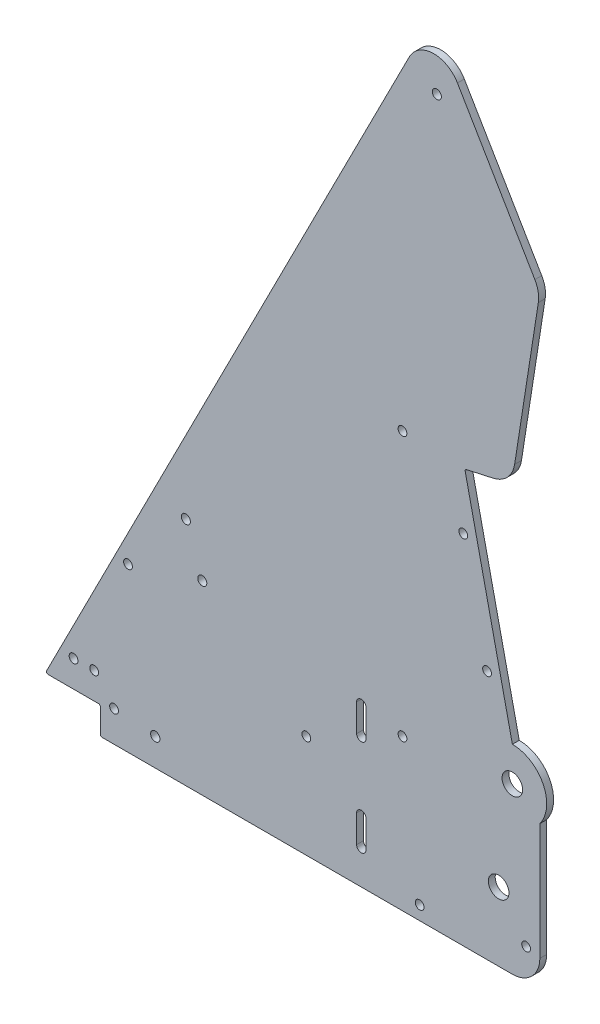
from build123d import *

# Parameters (mm, degrees)
BOSS_EXTRUDE1_DEPTH = 3.175
SKETCH2_R           = 2.0955
SKETCH2_R_2         = 2.032
SKETCH2_R_3         = 4.7625
CUT_EXTRUDE1_DEPTH  = 421.976111717
SKETCH7_R           = 2.159
CUT_EXTRUDE2_DEPTH  = 421.976111717
CUT_EXTRUDE3_REACH  = 422.976
SKETCH10_R          = 2.032
FILLET1_R           = 12.7
FILLET2_R           = 0.79375
SKETCH12_R          = 2.032
CUT_EXTRUDE5_DEPTH  = 410.593447353


with BuildPart() as part:
    # Sketch1 → Boss-Extrude1 (new body)
    with BuildSketch(Plane.XY):
        with BuildLine():
            Line((228.6, -12.7), (228.6, 53.975))
            ThreePointArc((228.6, 53.975), (230.099031657, 70.599515829), (215.9, 79.375))
            Line((215.9, 79.375), (193.909735224, 178.566674323))
            Line((193.909735224, 178.566674323), (215.607913982, 183.377044743))
            Line((215.607913982, 183.377044743), (228.6, 266.7))
            Line((228.6, 266.7), (178.754725958, 351.413083686))
            Line((178.754725958, 351.413083686), (0, 0))
            Line((0, 0), (25.4, 0))
            Line((25.4, 0), (25.4, -12.7))
            Line((25.4, -12.7), (228.6, -12.7))
        make_face()
    extrude(amount=BOSS_EXTRUDE1_DEPTH)

    # Sketch2 → Cut-Extrude1 (cut, through all)
    with BuildSketch(Plane.XY.offset(3.175)):
        with Locations((64.943150167, 94.057839899)):
            Circle(SKETCH2_R)
        with Locations((180.975, 322.164313376)):
            Circle(SKETCH2_R)
        with Locations((72.544547852, 73.173171402)):
            Circle(SKETCH2_R)
        with Locations((193.207821773, 152.394364194)):
            Circle(SKETCH2_R_2)
        with Locations((215.9, 63.5)):
            Circle(SKETCH2_R_3)
        with Locations((173.0375, -6.35)):
            Circle(SKETCH2_R_2)
        with Locations((204.202954161, 102.798527032)):
            Circle(SKETCH2_R_2)
        with Locations((209.55, 19.05)):
            Circle(SKETCH2_R_3)
        with Locations((165.1, 179.3875)):
            Circle(SKETCH2_R_2)
    extrude(amount=-CUT_EXTRUDE1_DEPTH, mode=Mode.SUBTRACT)

    # Sketch7 → Cut-Extrude2 (cut, through all)
    with BuildSketch(Plane.XY.offset(3.175)):
        with Locations((50.8, 0)):
            Circle(SKETCH7_R)
        with BuildLine():
            Line((143.891, 3.175), (143.891, 15.875))
            ThreePointArc((143.891, 15.875), (146.05, 18.034), (148.209, 15.875))
            Line((148.209, 15.875), (148.209, 3.175))
            ThreePointArc((148.209, 3.175), (146.05, 1.016), (143.891, 3.175))
        make_face()
        with BuildLine():
            Line((143.891, 47.625), (143.891, 60.325))
            ThreePointArc((143.891, 60.325), (146.05, 62.484), (148.209, 60.325))
            Line((148.209, 60.325), (148.209, 47.625))
            ThreePointArc((148.209, 47.625), (146.05, 45.466), (143.891, 47.625))
        make_face()
    extrude(amount=-CUT_EXTRUDE2_DEPTH, mode=Mode.SUBTRACT)

    # Sketch10 → Cut-Extrude3 (cut, up to next)
    with BuildSketch(Plane.XY.offset(3.175), mode=Mode.PRIVATE) as cut_extrude3_sk1:
        with Locations((165.1, 57.15)):
            Circle(SKETCH10_R)
    cut_extrude3_tool1 = extrude(cut_extrude3_sk1.sketch, amount=-CUT_EXTRUDE3_REACH, mode=Mode.PRIVATE) & part.part
    # Sketch10 → Cut-Extrude3 (cut, up to next)
    with BuildSketch(Plane.XY.offset(3.175), mode=Mode.PRIVATE) as cut_extrude3_sk2:
        with Locations((120.65, 34.925)):
            Circle(SKETCH10_R)
    cut_extrude3_tool2 = extrude(cut_extrude3_sk2.sketch, amount=-CUT_EXTRUDE3_REACH, mode=Mode.PRIVATE) & part.part
    # Sketch10 → Cut-Extrude3 (cut, up to next)
    with BuildSketch(Plane.XY.offset(3.175), mode=Mode.PRIVATE) as cut_extrude3_sk3:
        with Locations((13.046467246, 12.334704411)):
            Circle(SKETCH10_R)
    cut_extrude3_tool3 = extrude(cut_extrude3_sk3.sketch, amount=-CUT_EXTRUDE3_REACH, mode=Mode.PRIVATE) & part.part
    # Sketch10 → Cut-Extrude3 (cut, up to next)
    with BuildSketch(Plane.XY.offset(3.175), mode=Mode.PRIVATE) as cut_extrude3_sk4:
        with Locations((22.571467246, 12.334704411)):
            Circle(SKETCH10_R)
    cut_extrude3_tool4 = extrude(cut_extrude3_sk4.sketch, amount=-CUT_EXTRUDE3_REACH, mode=Mode.PRIVATE) & part.part
    # Sketch10 → Cut-Extrude3 (cut, up to next)
    with BuildSketch(Plane.XY.offset(3.175), mode=Mode.PRIVATE) as cut_extrude3_sk5:
        with Locations((38.211447917, 62.639810909)):
            Circle(SKETCH10_R)
    cut_extrude3_tool5 = extrude(cut_extrude3_sk5.sketch, amount=-CUT_EXTRUDE3_REACH, mode=Mode.PRIVATE) & part.part
    add(cut_extrude3_tool1.solids().sort_by_distance((165.1, 57.15, 3.175))[0], mode=Mode.SUBTRACT)
    add(cut_extrude3_tool2.solids().sort_by_distance((120.65, 34.925, 3.175))[0], mode=Mode.SUBTRACT)
    add(cut_extrude3_tool3.solids().sort_by_distance((13.046467, 12.334704, 3.175))[0], mode=Mode.SUBTRACT)
    add(cut_extrude3_tool4.solids().sort_by_distance((22.571467, 12.334704, 3.175))[0], mode=Mode.SUBTRACT)
    add(cut_extrude3_tool5.solids().sort_by_distance((38.211448, 62.639811, 3.175))[0], mode=Mode.SUBTRACT)

    # Fillet1
    fillet1_edges = [part.edges().sort_by_distance(p)[0] for p in [
        (228.6, -12.7, 1.5875),
        (178.754725958, 351.413083686, 1.5875),
        (215.607913982, 183.377044743, 1.5875),
        (228.6, 266.7, 1.5875),
    ]]
    fillet(fillet1_edges, radius=FILLET1_R)

    # Fillet2
    fillet2_edges = [part.edges().sort_by_distance(p)[0] for p in [
        (25.4, -12.7, 1.5875),
        (25.4, 0, 1.5875),
        (193.909735224, 178.566674323, 1.5875),
        (0, 0, 1.5875),
    ]]
    fillet(fillet2_edges, radius=FILLET2_R)

    # Sketch12 → Cut-Extrude5 (cut, through all)
    with BuildSketch(Plane.XY.offset(3.175)):
        with Locations((31.75, 1.5875)):
            Circle(SKETCH12_R)
        with Locations((222.25, 1.5875)):
            Circle(SKETCH12_R)
    extrude(amount=-CUT_EXTRUDE5_DEPTH, mode=Mode.SUBTRACT)


solid = part.part
